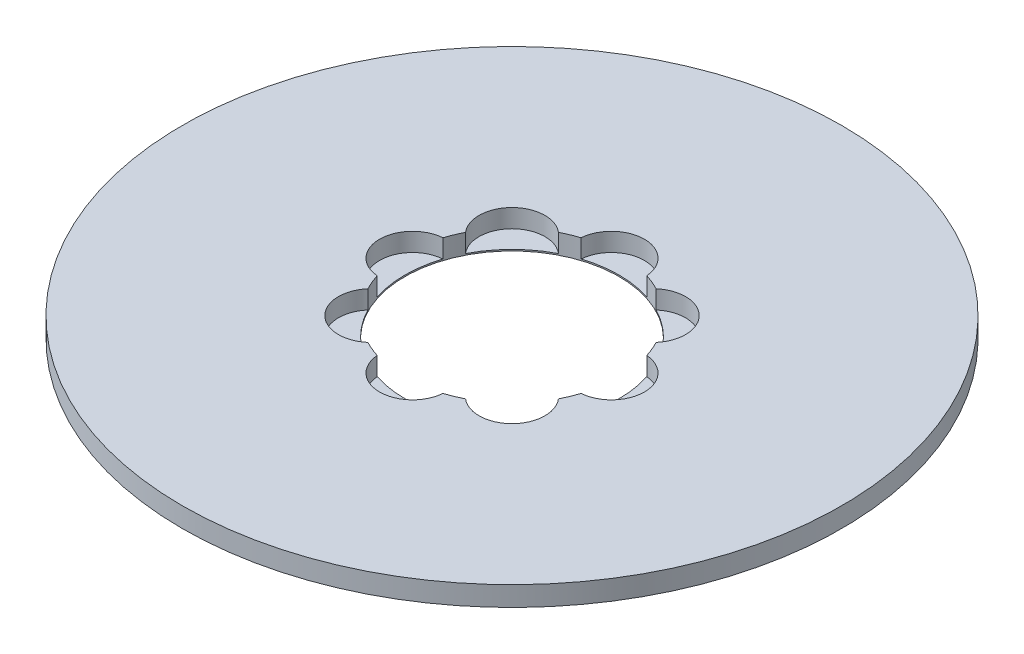
from build123d import *

# Parameters (mm, degrees)
SKETCH1_R           = 100
BOSS_EXTRUDE1_DEPTH = 6
SKETCH2_R           = 32.5
CUT_EXTRUDE1_DEPTH  = 142.548578234
SKETCH3_R           = 10
CUT_EXTRUDE2_DEPTH  = 5.5796884
CIRPATTERN1_COUNT   = 8


with BuildPart() as part:
    # Sketch1 → Boss-Extrude1 (new body)
    with BuildSketch(Plane(origin=(0, 0, 0), x_dir=(1, 0, 0), z_dir=(0, 1, 0))):
        Circle(SKETCH1_R)
    extrude(amount=BOSS_EXTRUDE1_DEPTH)

    # Sketch2 → Cut-Extrude1 (cut, through all)
    with BuildSketch(Plane(origin=(0, 0, 0), x_dir=(1, 0, 0), z_dir=(0, 1, 0))):
        Circle(SKETCH2_R)
    extrude(amount=CUT_EXTRUDE1_DEPTH, mode=Mode.SUBTRACT)

    # Sketch3 → Cut-Extrude2 (cut)
    with BuildSketch(Plane(origin=(0, 6, 0), x_dir=(1, 0, 0), z_dir=(0, 1, 0))):
        with Locations((-30.169509427, 0)):
            Circle(SKETCH3_R)
    cut_extrude2 = extrude(amount=-CUT_EXTRUDE2_DEPTH, mode=Mode.SUBTRACT)

    # CirPattern1: Cut-Extrude2 ×8 about axis
    cirpattern1_axis = Axis((0, 0, 0), (0, 1, 0))
    for i in range(1, CIRPATTERN1_COUNT):
        add(cut_extrude2.rotate(cirpattern1_axis, i * 360 / CIRPATTERN1_COUNT), mode=Mode.SUBTRACT)


solid = part.part
